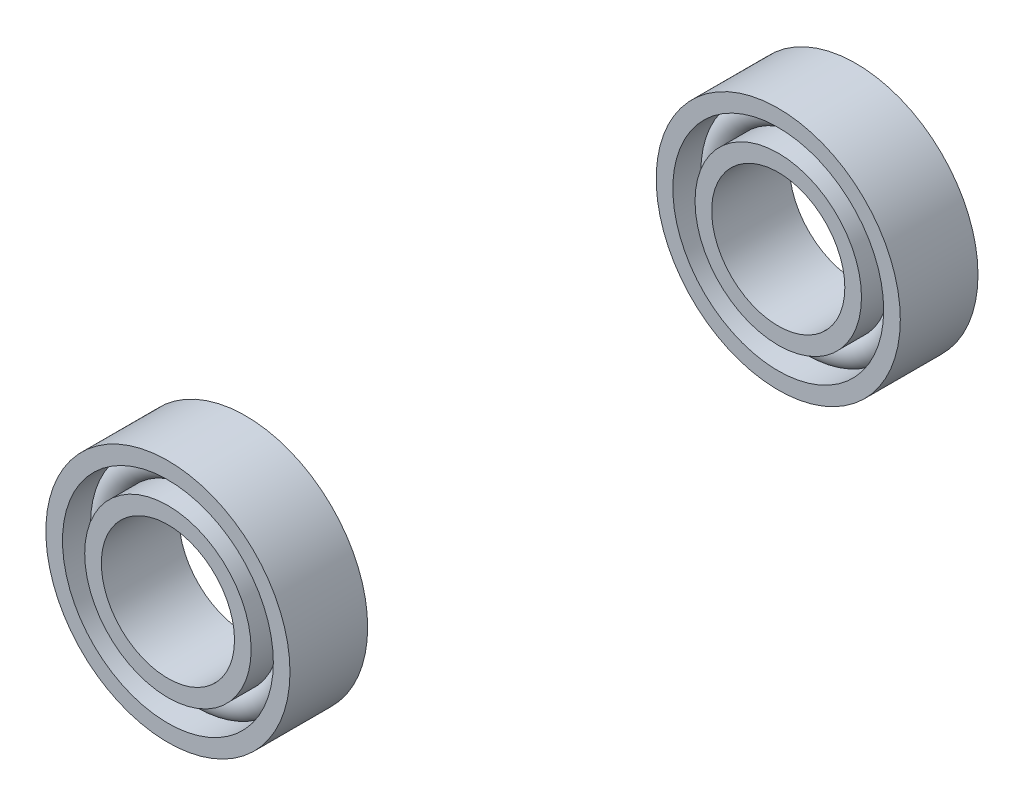
from build123d import *

# Parameters (mm, degrees)
SK_PISTA_INT_1_W = 1.5
SK_PISTA_INT_1_H = 7
SK_PISTA_EXT_1_W = 1.5
SK_PISTA_EXT_1_H = 7
SK_BOLAS_1_R     = 1.4
SK_PISTA_INT_2_W = 1.5
SK_PISTA_INT_2_H = 7
SK_PISTA_EXT_2_W = 1.5
SK_PISTA_EXT_2_H = 7
SK_BOLAS_2_R     = 1.4


with BuildPart() as part:
    # Sk_Pista_int_1 → Pista_int_1 (revolve)
    with BuildSketch(Plane(origin=(0, 0, 0), x_dir=(1, 0, 0), z_dir=(0, 1, 0))):
        with Locations((-179.25, 88)):
            Rectangle(SK_PISTA_INT_1_W, SK_PISTA_INT_1_H)
    revolve(axis=Axis((-172.5, 0, -79.5), (0, 0, -1)))



with BuildPart() as body_2:
    # Sk_Pista_ext_1 → Pista_ext_1 (revolve)
    with BuildSketch(Plane(origin=(0, 0, 0), x_dir=(1, 0, 0), z_dir=(0, 1, 0))):
        with Locations((-182.75, 88)):
            Rectangle(SK_PISTA_EXT_1_W, SK_PISTA_EXT_1_H)
    revolve(axis=Axis((-172.5, 0, -79.5), (0, 0, -1)))


with BuildPart() as part_1:
    add(part.part)

    add(body_2.part)  # Bolas_1 merges body 2
    # Sk_Bolas_1 → Bolas_1 (revolve)
    with BuildSketch(Plane(origin=(0, 0, 0), x_dir=(1, 0, 0), z_dir=(0, 1, 0))):
        with Locations((-181, 88)):
            Circle(SK_BOLAS_1_R)
    revolve(axis=Axis((-172.5, 0, -83), (0, 0, -1)))


with BuildPart() as body_2_2:
    # Sk_Pista_int_2 → Pista_int_2 (revolve)
    with BuildSketch(Plane(origin=(0, 0, 0), x_dir=(1, 0, 0), z_dir=(0, 1, 0))):
        with Locations((-179.25, 143)):
            Rectangle(SK_PISTA_INT_2_W, SK_PISTA_INT_2_H)
    revolve(axis=Axis((-172.5, 0, -134.5), (0, 0, -1)))



with BuildPart() as body_3:
    # Sk_Pista_ext_2 → Pista_ext_2 (revolve)
    with BuildSketch(Plane(origin=(0, 0, 0), x_dir=(1, 0, 0), z_dir=(0, 1, 0))):
        with Locations((-182.75, 143)):
            Rectangle(SK_PISTA_EXT_2_W, SK_PISTA_EXT_2_H)
    revolve(axis=Axis((-172.5, 0, -134.5), (0, 0, -1)))


with BuildPart() as body_2_2_1:
    add(body_2_2.part)

    add(body_3.part)  # Bolas_2 merges body 3
    # Sk_Bolas_2 → Bolas_2 (revolve)
    with BuildSketch(Plane(origin=(0, 0, 0), x_dir=(1, 0, 0), z_dir=(0, 1, 0))):
        with Locations((-181, 143)):
            Circle(SK_BOLAS_2_R)
    revolve(axis=Axis((-172.5, 0, -138), (0, 0, -1)))


solid = Compound([part_1.part, body_2_2_1.part])
